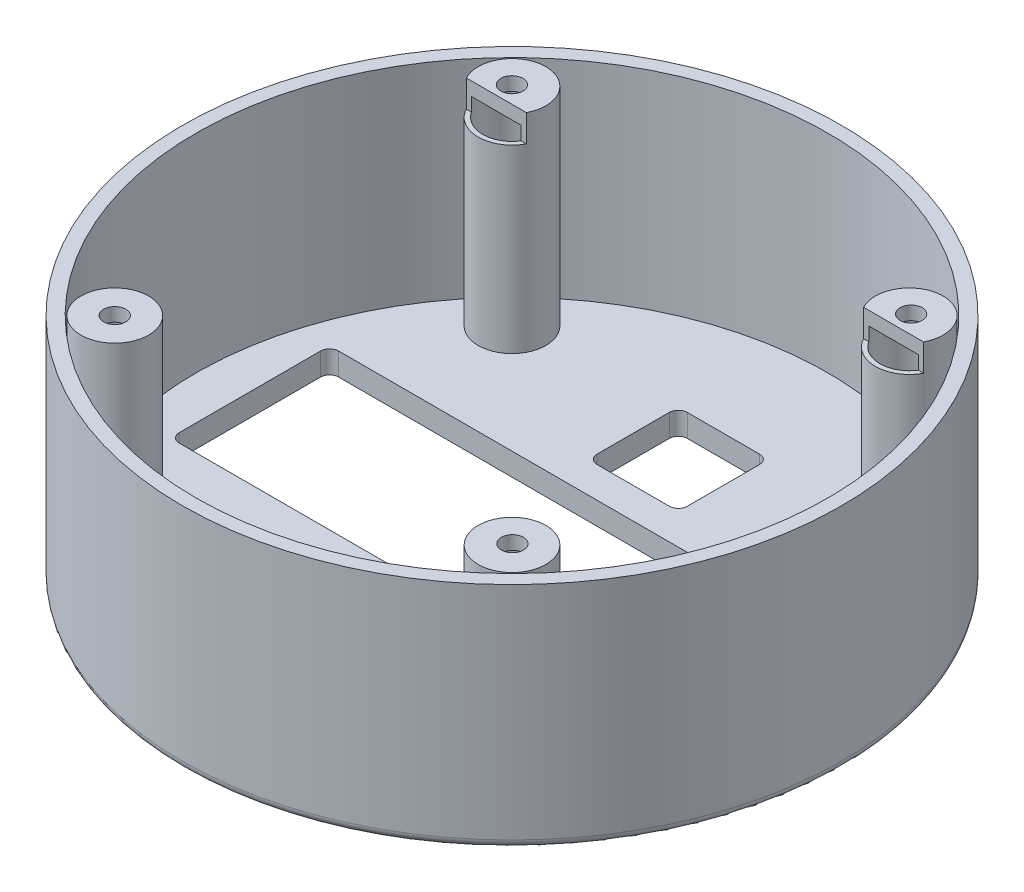
from build123d import *

# Parameters (mm, degrees)
SKETCH2_R           = 36.5
BOSS_EXTRUDE1_DEPTH = 2.5
SKETCH3_R           = 36.5
SKETCH3_R_2         = 35
BOSS_EXTRUDE2_DEPTH = 35
SKETCH4_R           = 3.75
BOSS_EXTRUDE3_DEPTH = 35
SKETCH5_R           = 1.225
CUT_EXTRUDE2_DEPTH  = 64.802429421
CUT_EXTRUDE7_START  = -24
SKETCH9_R           = 3.25
SKETCH9_R_2         = 1.225
CUT_EXTRUDE7_DEPTH  = 24
FILLET2_R           = 0.75
SKETCH17_W          = 10
SKETCH17_H          = 10
CUT_EXTRUDE9_DEPTH  = 10
SKETCH19_W          = 60.448509469
SKETCH19_H          = 17.659938419
CUT_EXTRUDE10_DEPTH = 10
FILLET8_R           = 1
FILLET9_R           = 1
FILLET10_R          = 1
FILLET11_R          = 1
FILLET7_R           = 1
CUT_EXTRUDE11_START = -12
SKETCH20_R          = 36.5
CUT_EXTRUDE11_DEPTH = 12
SKETCH21_W          = 50.64390868
SKETCH21_H          = 2.55548202
CUT_EXTRUDE13_DEPTH = 3


with BuildPart() as part:
    # Sketch2 → Boss-Extrude1 (new body)
    with BuildSketch(Plane(origin=(0, 0, 0), x_dir=(1, 0, 0), z_dir=(0, 1, 0))):
        Circle(SKETCH2_R)
    extrude(amount=BOSS_EXTRUDE1_DEPTH)

    # Sketch3 → Boss-Extrude2 (add)
    with BuildSketch(Plane(origin=(0, 2.5, 0), x_dir=(1, 0, 0), z_dir=(0, 1, 0))):
        Circle(SKETCH3_R)
        Circle(SKETCH3_R_2, mode=Mode.SUBTRACT)
    extrude(amount=BOSS_EXTRUDE2_DEPTH)

    # Sketch4 → Boss-Extrude3 (add)
    with BuildSketch(Plane(origin=(0, 2.5, 0), x_dir=(1, 0, 0), z_dir=(0, 1, 0))):
        with Locations((-22, 22)):
            Circle(SKETCH4_R)
        with Locations((22, 22)):
            Circle(SKETCH4_R)
        with Locations((22, -22)):
            Circle(SKETCH4_R)
        with Locations((-22, -22)):
            Circle(SKETCH4_R)
    extrude(amount=BOSS_EXTRUDE3_DEPTH)

    # Sketch5 → Cut-Extrude2 (cut, through all)
    with BuildSketch(Plane(origin=(0, 37.5, 0), x_dir=(1, 0, 0), z_dir=(0, 1, 0))):
        with Locations((-22, -22)):
            Circle(SKETCH5_R)
        with Locations((-22.145028028, 22.135381056)):
            Circle(SKETCH5_R)
        with Locations((21.959827612, 22.246616506)):
            Circle(SKETCH5_R)
        with Locations((21.904209888, -21.858239135)):
            Circle(SKETCH5_R)
    extrude(amount=-CUT_EXTRUDE2_DEPTH, mode=Mode.SUBTRACT)

    # Sketch9 → Cut-Extrude7 (cut)
    # profile 1 of 4: a face of its own
    with BuildSketch(Plane.XZ.offset(CUT_EXTRUDE7_START)):
        with Locations((-22, 22)):
            Circle(SKETCH9_R)
        with Locations((-22, 22)):
            Circle(SKETCH9_R_2, mode=Mode.SUBTRACT)
    # profile 2 of 4: a face of its own
    with BuildSketch(Plane.XZ.offset(CUT_EXTRUDE7_START)):
        with Locations((22, 22)):
            Circle(SKETCH9_R)
        with Locations((21.904209888, 21.858239135)):
            Circle(SKETCH9_R_2, mode=Mode.SUBTRACT)
    # profile 3 of 4: a face of its own
    with BuildSketch(Plane.XZ.offset(CUT_EXTRUDE7_START)):
        with Locations((-22, -22)):
            Circle(SKETCH9_R)
        with Locations((-22.145028028, -22.135381056)):
            Circle(SKETCH9_R_2, mode=Mode.SUBTRACT)
    # profile 4 of 4: a face of its own
    with BuildSketch(Plane.XZ.offset(CUT_EXTRUDE7_START)):
        with Locations((22, -22)):
            Circle(SKETCH9_R)
        with Locations((21.959827612, -22.246616506)):
            Circle(SKETCH9_R_2, mode=Mode.SUBTRACT)
    extrude(amount=CUT_EXTRUDE7_DEPTH, mode=Mode.SUBTRACT)

    # Fillet2
    fillet2_edges = [part.edges().sort_by_distance(p)[0] for p in [
        (-35, 37.5, 0),
    ]]
    fillet(fillet2_edges, radius=FILLET2_R)

    # Sketch17 → Cut-Extrude9 (cut)
    with BuildSketch(Plane.XZ):
        with Locations((0, -18.418957296)):
            Rectangle(SKETCH17_W, SKETCH17_H)
    extrude(amount=-CUT_EXTRUDE9_DEPTH, mode=Mode.SUBTRACT)

    # Sketch19 → Cut-Extrude10 (cut)
    with BuildSketch(Plane.XZ):
        with Locations((0.023287933, -1.164693847)):
            Rectangle(SKETCH19_W, SKETCH19_H)
    extrude(amount=-CUT_EXTRUDE10_DEPTH, mode=Mode.SUBTRACT)

    # Fillet8
    fillet8_edges = [part.edges().sort_by_distance(p)[0] for p in [
        (5, 1.25, -23.418957296),
        (30.247542668, 1.25, -9.994663056),
    ]]
    fillet(fillet8_edges, radius=FILLET8_R)

    # Fillet9
    fillet9_edges = [part.edges().sort_by_distance(p)[0] for p in [
        (-5, 1.25, -13.418957296),
        (-30.200966801, 1.25, 7.665275363),
    ]]
    fillet(fillet9_edges, radius=FILLET9_R)

    # Fillet10
    fillet10_edges = [part.edges().sort_by_distance(p)[0] for p in [
        (5, 1.25, -13.418957296),
        (30.247542668, 1.25, 7.665275363),
    ]]
    fillet(fillet10_edges, radius=FILLET10_R)

    # Fillet11
    fillet11_edges = [part.edges().sort_by_distance(p)[0] for p in [
        (-30.200966801, 1.25, -9.994663056),
        (-5, 1.25, -23.418957296),
    ]]
    fillet(fillet11_edges, radius=FILLET11_R)

    # Fillet7
    fillet7_edges = [part.edges().sort_by_distance(p)[0] for p in [
        (-36.5, 0, 0),
    ]]
    fillet(fillet7_edges, radius=FILLET7_R)

    # Sketch20 → Cut-Extrude11 (cut)
    with BuildSketch(Plane(origin=(0, 37.5, 0), x_dir=(1, 0, 0), z_dir=(0, 1, 0)).offset(CUT_EXTRUDE11_START)):
        Circle(SKETCH20_R)
    extrude(amount=CUT_EXTRUDE11_DEPTH, mode=Mode.SUBTRACT)

    # Sketch21 → Cut-Extrude13 (cut)
    with BuildSketch(Plane(origin=(0, 25.5, 0), x_dir=(1, 0, 0), z_dir=(0, 1, 0))):
        with Locations((0, 18.98239711)):
            Rectangle(SKETCH21_W, SKETCH21_H)
    extrude(amount=-CUT_EXTRUDE13_DEPTH, mode=Mode.SUBTRACT)


solid = part.part
